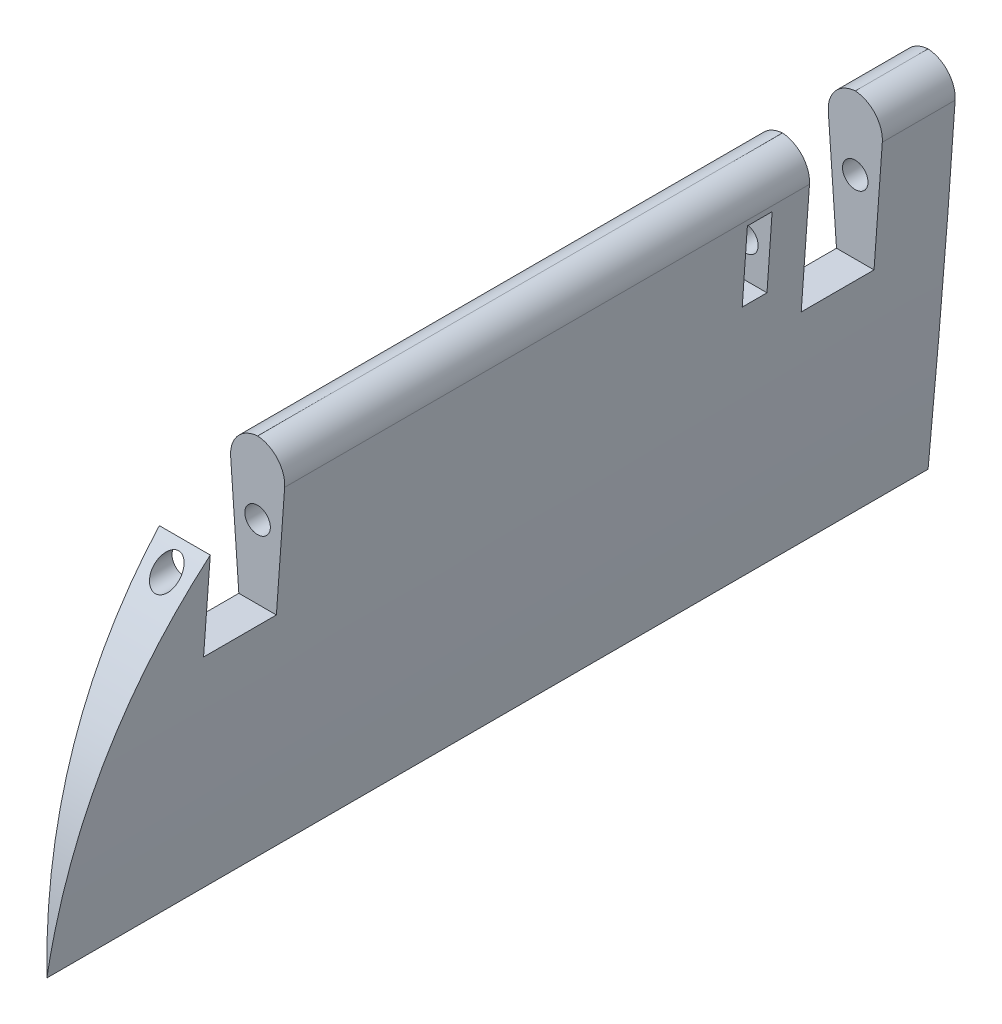
from build123d import *

# Parameters (mm, degrees)
SKETCH_2_R               = 3.25
EXTRUDE_1_DEPTH          = 150
CUT_EXTRUDE_START        = -5.375917787
CUT_EXTRUDE_1_DEPTH      = 10.820362331
CUT_EXTRUDE_2_DEPTH      = 178.636263262
CUT_EXTRUDE_2_DEPTH_BACK = 178.636263262
SKETCH_5_R               = 1.75
CUT_EXTRUDE_3_DEPTH      = 154.889291752
FILLET_1_R               = 4
CUT_EXTRUDE_4_DEPTH      = 164.486604715
CUT_EXTRUDE_4_DEPTH_BACK = 164.486604715
SKETCH_8_W               = 10
SKETCH_8_H               = 20
CUT_EXTRUDE_5_DEPTH      = 164.486604715
CUT_EXTRUDE_5_DEPTH_BACK = 164.486604715
SKETCH_9_W               = 3.4
SKETCH_9_H               = 10


# Read off the part's stored shape, not the designer's step: 除料-伸長1
with BuildPart() as part:
    # 草圖2 → 填料-伸長1 (new body)
    with BuildSketch(Plane.XY):
        with BuildLine():
            add(Edge.make_bspline(
                [(-4.885261194, 10), (0, 40), (5, 10)],
                knots=[0, 0, 0, 1, 1, 1], degree=2))
            add(Edge.make_bspline(
                [(5, 10), (7, -20), (0, -95)],
                knots=[0, 0, 0, 1, 1, 1], degree=2))
            add(Edge.make_bspline(
                [(-4.885261194, 10), (-7, -20), (0, -95)],
                knots=[0, 0, 0, 1, 1, 1], degree=2))
        make_face()
        with Locations((0, 5)):
            Circle(SKETCH_2_R, mode=Mode.SUBTRACT)
        with Locations((0, -15)):
            Circle(SKETCH_2_R, mode=Mode.SUBTRACT)
    extrude(amount=EXTRUDE_1_DEPTH)

    # 除料-伸長1 outline → 除料-伸長1 (cut)
    with BuildSketch(Plane(origin=(0, 0, 0), x_dir=(0, 0, -1), z_dir=(1, 0, 0)).offset(CUT_EXTRUDE_START)):
        with BuildLine():
            Line((-150, 25), (-150, -80.493578612))
            add(Edge.make_bspline(
                [(-45.078048967, 25), (-92.099367892, 5.715924734), (-132.413995221, -32.343019704), (-150, -80.493578612)],
                knots=[0, 0, 0, 0, 1, 1, 1, 1], degree=3))
            Line((-45.078048967, 25), (-150, 25))
        make_face()
    extrude(amount=CUT_EXTRUDE_1_DEPTH, mode=Mode.SUBTRACT)

    # 草圖4 → 除料-伸長2 (cut, two sides: drawn at the far end of the back side and taken through both)
    with BuildSketch(Plane(origin=(0, 0, 0), x_dir=(0, 0, -1), z_dir=(1, 0, 0)).offset(-CUT_EXTRUDE_2_DEPTH_BACK)):
        with BuildLine():
            Line((-12, -95), (-12, -45))
            Line((-12, -45), (-105.048136882, -45))
            add(Edge.make_bspline(
                [(-105.048136882, -45), (-130.619727744, -62.828669631), (-133, -95)],
                knots=[0, 0, 0, 1, 1, 1], degree=2))
            Line((-133, -95), (-202.799866115, -110.736264896))
            Line((-202.799866115, -110.736264896), (-206.293444292, 4.551814945))
            Line((-206.293444292, 4.551814945), (-122.032968562, 45.937279504))
            Line((-122.032968562, 45.937279504), (-2.049657297, 49.573137421))
            Line((-2.049657297, 49.573137421), (77.223861612, 25.244547225))
            Line((77.223861612, 25.244547225), (93.885542148, -58.870065807))
            Line((93.885542148, -58.870065807), (27.807345311, -110.736264896))
            Line((27.807345311, -110.736264896), (-12, -95))
        make_face()
    extrude(amount=CUT_EXTRUDE_2_DEPTH + CUT_EXTRUDE_2_DEPTH_BACK, mode=Mode.SUBTRACT)

    # 草圖5 → 除料-伸長3 (cut, through all)
    with BuildSketch(Plane(origin=(0, 0, 12), x_dir=(-1, 0, 0), z_dir=(0, 0, -1))):
        with Locations(Location((0, -55, 0), (0, 0, 90))):
            Circle(SKETCH_5_R)
    extrude(amount=-CUT_EXTRUDE_3_DEPTH, mode=Mode.SUBTRACT)

    # 圓角1
    # the kernel refuses this fillet: 4 mm, written as the material it takes off along each edge
    with BuildSketch(Plane(origin=(-3.97305147, -45, 115.722141015), x_dir=(0.06337202796258917, -0.9979899729315466, 0), z_dir=(0, 0, -1))) as fillet_1_piece_1:
        with BuildLine():
            CenterArc((4.262054506, -3.99999288), FILLET_1_R, 89.891895008, 93.74148946)
            Line((0.270094614, -4.253480992), (0, 0))
            ThreePointArc((0, 0), (2.134800854, 0.002041927), (4.269601653, 0))
        make_face()
    extrude(amount=114.396145149, mode=Mode.SUBTRACT)
    with BuildSketch(Plane(origin=(3.989244513, -45, 115.729130337), x_dir=(-0.06406540579517839, -0.9979457018196427, 0), z_dir=(0, 0, -1))) as fillet_1_piece_2:
        with BuildLine():
            CenterArc((4.265022816, 3.999993202), FILLET_1_R, 176.326807013, 93.77882592)
            Line((0.273240009, 4.256254825), (0, 0))
            ThreePointArc((0, 0), (2.136198717, -0.001996553), (4.272397382, 0))
        make_face()
    extrude(amount=114.410123792, mode=Mode.SUBTRACT)

    # 草圖8 → 除料-伸長4 (cut, two sides: drawn at the far end of the back side and taken through both)
    with BuildSketch(Plane(origin=(0, 0, 0), x_dir=(0, 0, -1), z_dir=(1, 0, 0)).offset(-CUT_EXTRUDE_4_DEPTH_BACK)):
        with Locations((-27, -55.009980051)):
            Rectangle(SKETCH_8_W, SKETCH_8_H)
        with Locations((-109.062447802, -55.009980051)):
            Rectangle(SKETCH_8_W, SKETCH_8_H)
    extrude(amount=CUT_EXTRUDE_4_DEPTH + CUT_EXTRUDE_4_DEPTH_BACK, mode=Mode.SUBTRACT)

    # 草圖9 → 除料-伸長5 (cut, two sides: drawn at the far end of the back side and taken through both)
    with BuildSketch(Plane(origin=(0, 0, 0), x_dir=(0, 0, -1), z_dir=(1, 0, 0)).offset(-CUT_EXTRUDE_5_DEPTH_BACK)):
        with Locations((-38.78, -55)):
            Rectangle(SKETCH_9_W, SKETCH_9_H)
    extrude(amount=CUT_EXTRUDE_5_DEPTH + CUT_EXTRUDE_5_DEPTH_BACK, mode=Mode.SUBTRACT)


solid = part.part
